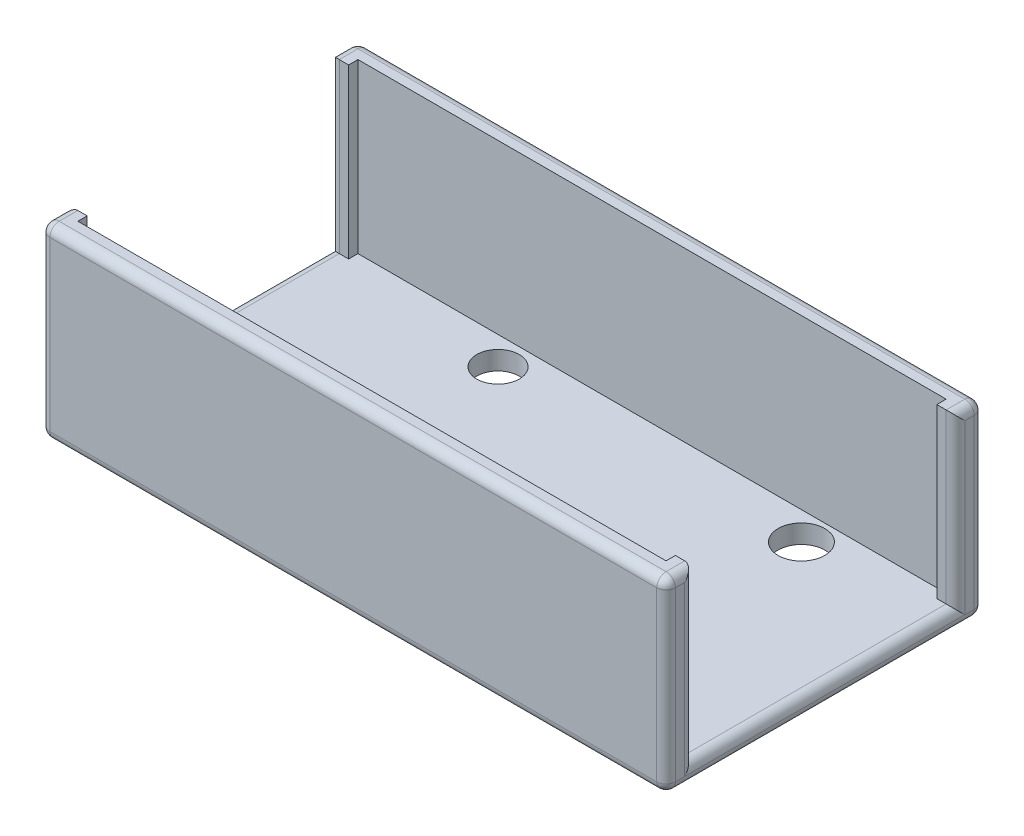
from build123d import *

# Parameters (mm, degrees)
SKETCH1_W           = 67
SKETCH1_H           = 34
BOSS_EXTRUDE1_DEPTH = 20
SKETCH4_W           = 63
SKETCH4_H           = 30
CUT_EXTRUDE1_DEPTH  = 18
SKETCH5_W           = 28
SKETCH5_H           = 18
CUT_EXTRUDE4_DEPTH  = 2
SKETCH8_W           = 28
SKETCH8_H           = 18
CUT_EXTRUDE5_DEPTH  = 2
SKETCH9_R           = 2.5
SKETCH9_R_2         = 2.277231992
CUT_EXTRUDE6_DEPTH  = 2
FILLET1_R           = 1


with BuildPart() as part:
    # Sketch1 → Boss-Extrude1 (new body)
    with BuildSketch(Plane(origin=(0, 0, 0), x_dir=(1, 0, 0), z_dir=(0, 1, 0))):
        Rectangle(SKETCH1_W, SKETCH1_H)
    extrude(amount=BOSS_EXTRUDE1_DEPTH)

    # Sketch4 → Cut-Extrude1 (cut)
    with BuildSketch(Plane(origin=(0, 20, 0), x_dir=(1, 0, 0), z_dir=(0, 1, 0))):
        Rectangle(SKETCH4_W, SKETCH4_H)
    extrude(amount=-CUT_EXTRUDE1_DEPTH, mode=Mode.SUBTRACT)

    # Sketch5 → Cut-Extrude4 (cut)
    with BuildSketch(Plane(origin=(33.5, 0, 0), x_dir=(0, 0, -1), z_dir=(1, 0, 0))):
        with Locations((0, 11)):
            Rectangle(SKETCH5_W, SKETCH5_H)
    extrude(amount=-CUT_EXTRUDE4_DEPTH, mode=Mode.SUBTRACT)

    # Sketch8 → Cut-Extrude5 (cut)
    with BuildSketch(Plane.ZY.offset(33.5)):
        with Locations((0, 11)):
            Rectangle(SKETCH8_W, SKETCH8_H)
    extrude(amount=-CUT_EXTRUDE5_DEPTH, mode=Mode.SUBTRACT)

    # Sketch9 → Cut-Extrude6 (cut)
    with BuildSketch(Plane.XZ):
        with Locations(Location((19, 12, 0), (0, 0, 270))):
            Circle(SKETCH9_R)
        with Locations(Location((19, -12, 0), (0, 0, 90))):
            Circle(SKETCH9_R)
        with Locations(Location((-13.5, 12, 0), (0, 0, 270))):
            Circle(SKETCH9_R_2)
        with Locations(Location((-13.5, -12, 0), (0, 0, 90))):
            Circle(SKETCH9_R_2)
    extrude(amount=-CUT_EXTRUDE6_DEPTH, mode=Mode.SUBTRACT)

    # Fillet1
    fillet1_edges = [part.edges().sort_by_distance(p)[0] for p in [
        (-33.5, 20, -15.5),
        (0, 20, 17),
        (33.5, 20, -15.5),
        (33.5, 11, -14),
        (33.5, 11, 14),
        (33.5, 2, 0),
        (-33.5, 20, 15.5),
        (-33.5, 11, 14),
        (-33.5, 11, -14),
        (-33.5, 2, 0),
        (33.5, 20, 15.5),
        (0, 0, 17),
        (-33.5, 0, 0),
        (0, 0, -17),
        (33.5, 0, 0),
        (33.5, 10, 17),
        (-33.5, 10, 17),
        (-33.5, 10, -17),
        (33.5, 10, -17),
        (0, 20, -17),
    ]]
    fillet(fillet1_edges, radius=FILLET1_R - 0.0001)  # a hair under: the kernel refuses the full size


solid = part.part
